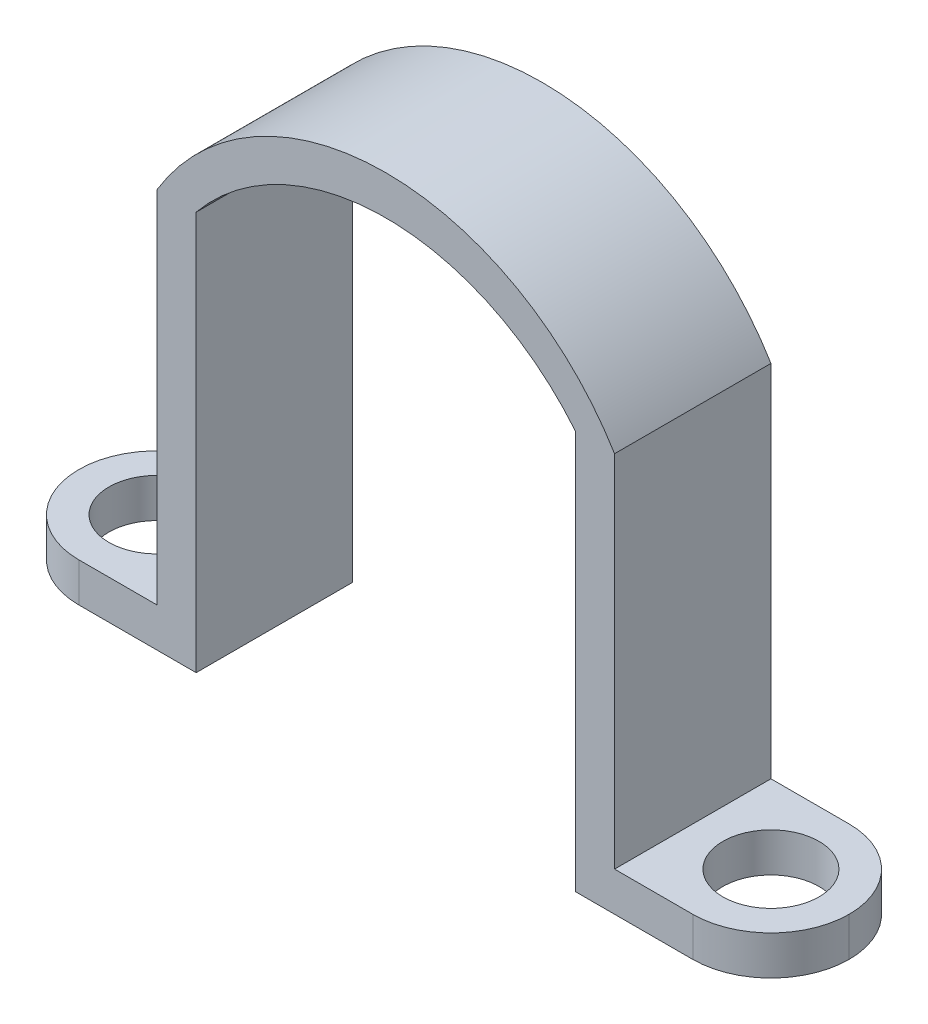
from build123d import *

# Parameters (mm, degrees)
BOSS_EXTRUDE1_DEPTH = 5.08
FILLET1_R           = 2.54
SKETCH2_R           = 1.5625
CUT_EXTRUDE1_DEPTH  = 26.027057078


with BuildPart() as part:
    # Sketch1 → Boss-Extrude1 (new body)
    with BuildSketch(Plane.XY):
        with BuildLine():
            Line((18.669, -23.469960484), (12.319, -23.469960484))
            Line((12.319, -23.469960484), (12.319, -10.515960484))
            ThreePointArc((12.319, -10.515960484), (6.1595, -7.594960484), (0, -10.515960484))
            Line((0, -10.515960484), (0, -23.469960484))
            Line((0, -23.469960484), (-6.35, -23.469960484))
            Line((-6.35, -23.469960484), (-6.35, -22.199960484))
            Line((-6.35, -22.199960484), (-1.27, -22.199960484))
            Line((-1.27, -22.199960484), (-1.27, -10.515960484))
            ThreePointArc((-1.27, -10.515960484), (6.1595, -6.324960484), (13.589, -10.515960484))
            Line((13.589, -10.515960484), (13.589, -22.199960484))
            Line((13.589, -22.199960484), (18.669, -22.199960484))
            Line((18.669, -22.199960484), (18.669, -23.469960484))
        make_face()
    extrude(amount=BOSS_EXTRUDE1_DEPTH)

    # Fillet1
    fillet1_edges = [part.edges().sort_by_distance(p)[0] for p in [
        (-6.35, -22.834960484, 0),
        (-6.35, -22.834960484, 5.08),
        (18.669, -22.834960484, 0),
        (18.669, -22.834960484, 5.08),
    ]]
    fillet(fillet1_edges, radius=FILLET1_R - 0.0001)  # a hair under: the kernel refuses the full size

    # Sketch2 → Cut-Extrude1 (cut, through all)
    with BuildSketch(Plane(origin=(0, -22.199960484, 0), x_dir=(1, 0, 0), z_dir=(0, 1, 0))):
        with Locations(Location((16.129, -2.54, 0), (0, 0, 270))):
            Circle(SKETCH2_R)
        with Locations(Location((-3.81, -2.54, 0), (0, 0, 270))):
            Circle(SKETCH2_R)
    extrude(amount=-CUT_EXTRUDE1_DEPTH, mode=Mode.SUBTRACT)


solid = part.part
